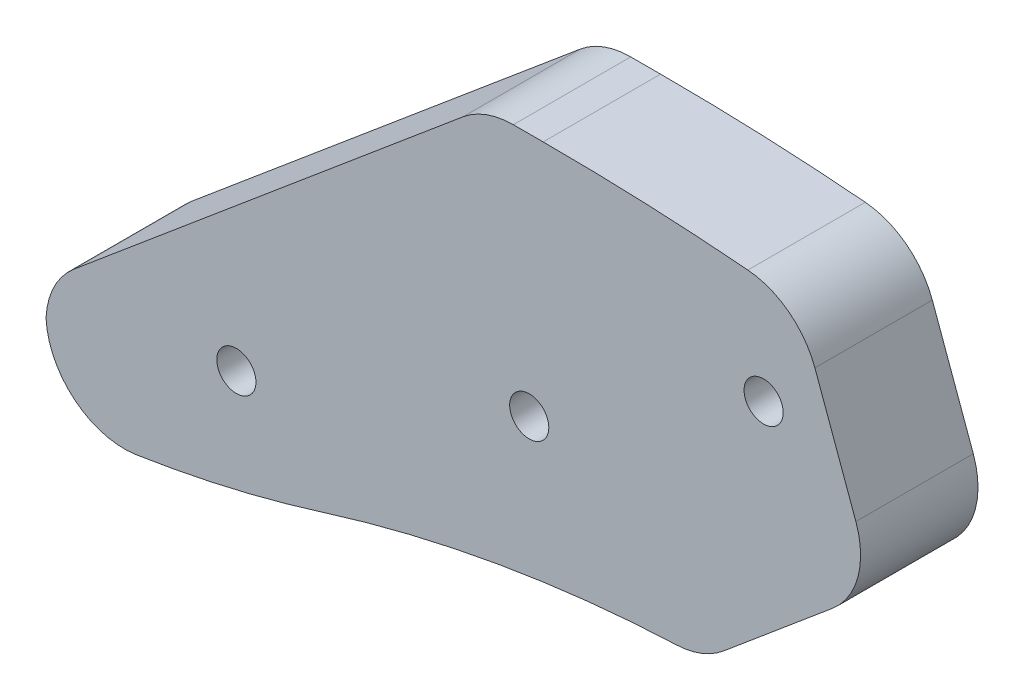
from build123d import *

# Parameters (mm, degrees)
BOSS_EXTRUDE1_DEPTH = 12
SKETCH4_R           = 2
CUT_EXTRUDE2_DEPTH  = 100.249994256
FILLET2_R           = 8


with BuildPart() as part:
    # Sketch1 → Boss-Extrude1 (new body)
    with BuildSketch(Plane.XY):
        with BuildLine():
            Line((61.423127431, 25), (55.463282958, 25))
            Line((55.463282958, 25), (10.60599556, -12.639733311))
            Line((10.60599556, -12.639733311), (10.60599556, -24.566634818))
            ThreePointArc((10.60599556, -24.566634818), (24.944333721, -22.584404279), (38.973425347, -19.020450397))
            ThreePointArc((38.973425347, -19.020450397), (58.129824232, -14.452456897), (77.737673628, -12.617674908))
            Line((77.737673628, -12.617674908), (95.297226402, 2.116539348))
            Line((95.297226402, 2.116539348), (87.463282958, 23.640122064))
            ThreePointArc((87.463282958, 23.640122064), (74.460947109, 24.659799043), (61.423127431, 25))
        make_face()
    extrude(amount=BOSS_EXTRUDE1_DEPTH)

    # Sketch4 → Cut-Extrude2 (cut, through all)
    with BuildSketch(Plane.XY.offset(12)):
        with Locations((30.070163865, -10.944644586)):
            Circle(SKETCH4_R)
        with Locations((83.953508951, 13.296929528)):
            Circle(SKETCH4_R)
        with Locations((60, 0)):
            Circle(SKETCH4_R)
    extrude(amount=-CUT_EXTRUDE2_DEPTH, mode=Mode.SUBTRACT)

    # Fillet2
    # the kernel refuses this fillet: 8 mm, written as the material it takes off along each edge
    with BuildSketch(Plane(origin=(77.737673628, -12.617674908, -6.911835491), x_dir=(0.7660444431189745, 0.6427876096865436, 0), z_dir=(0, 0, 1))) as fillet2_piece_1:
        with BuildLine():
            CenterArc((2.764734197, 8), FILLET2_R, 232.413146156, 37.586853844)
            ThreePointArc((-2.114972699, 1.660563068), (-1.053499463, 0.835359424), (0, 0))
            Line((0, 0), (2.764734197, 0))
        make_face()
    extrude(amount=25.823670983, mode=Mode.SUBTRACT)
    with BuildSketch(Plane(origin=(10.60599556, -24.566634818, -23.209901988), x_dir=(0, 1, 0), z_dir=(0, 0, 1))) as fillet2_piece_2:
        with BuildLine():
            CenterArc((8.993765029, -8), FILLET2_R, 90, 98.772306206)
            ThreePointArc((1.087347338, -9.220065283), (0.461340951, -4.619742362), (0, 0))
            Line((0, 0), (8.993765029, 0))
        make_face()
    extrude(amount=58.419803977, mode=Mode.SUBTRACT)
    with BuildSketch(Plane(origin=(10.60599556, -12.639733311, -9.326153163), x_dir=(0.7660444431189766, 0.6427876096865411, 0), z_dir=(0, 0, 1))) as fillet2_piece_3:
        with BuildLine():
            CenterArc((FILLET2_R * 0.466307658155, -FILLET2_R), FILLET2_R, 90, 50)
            Line((-FILLET2_R * 0.299736784964, -FILLET2_R * 0.357212390313), (0, 0))
            Line((0, 0), (FILLET2_R * 0.466307658155, 0))
        make_face()
    extrude(amount=30.652306326, mode=Mode.SUBTRACT)
    with BuildSketch(Plane(origin=(95.297226402, 2.116539348, -14.004150764), x_dir=(-0.34202014332566766, 0.9396926207859088, 0), z_dir=(0, 0, 1))) as fillet2_piece_4:
        with BuildLine():
            CenterArc((FILLET2_R * 0.70020753821, FILLET2_R), FILLET2_R, 200, 70)
            Line((-FILLET2_R * 0.239485082576, FILLET2_R * 0.657979856674), (0, 0))
            Line((0, 0), (FILLET2_R * 0.70020753821, 0))
        make_face()
    extrude(amount=40.008301528, mode=Mode.SUBTRACT)
    with BuildSketch(Plane(origin=(87.463282958, 23.640122064, -12.852127182), x_dir=(-0.9955788661369174, 0.0939293420690782, 0), z_dir=(0, 0, 1))) as fillet2_piece_5:
        with BuildLine():
            CenterArc((5.058597259, 7.999577135), FILLET2_R, 205.389700078, 65.199408418)
            Line((-2.168701836, 4.569395246), (0, 0))
            ThreePointArc((0, 0), (2.570425436, -0.013214523), (5.140850873, 0))
        make_face()
    extrude(amount=37.704254365, mode=Mode.SUBTRACT)
    with BuildSketch(Plane(origin=(55.463282958, 25, -7.279404685), x_dir=(1, 0, 0), z_dir=(0, 0, 1))) as fillet2_piece_6:
        with BuildLine():
            CenterArc((FILLET2_R * 0.363970234266, -FILLET2_R), FILLET2_R, 90, 40)
            Line((-FILLET2_R * 0.27881737542, -FILLET2_R * 0.233955556881), (0, 0))
            Line((0, 0), (FILLET2_R * 0.363970234266, 0))
        make_face()
    extrude(amount=26.558809371, mode=Mode.SUBTRACT)


solid = part.part
